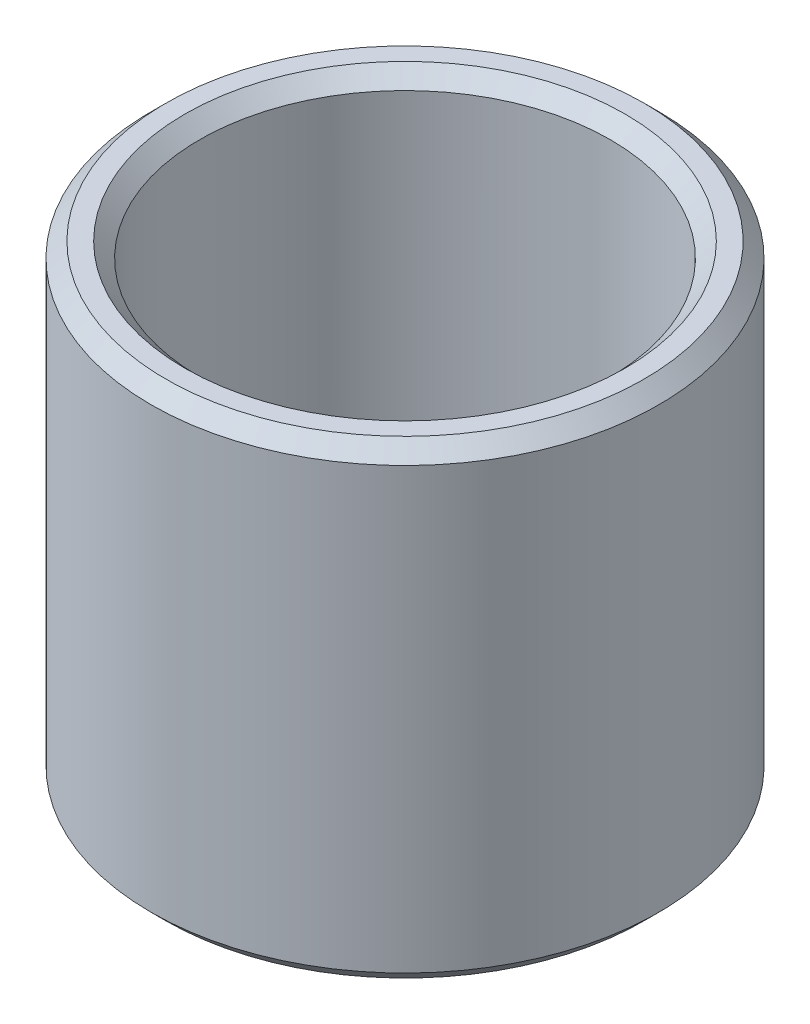
from build123d import *

# Parameters (mm, degrees)
SKETCH1_R           = 60
BOSS_EXTRUDE1_DEPTH = 110.872640761
SKETCH2_R           = 48.534594652
CUT_EXTRUDE1_DEPTH  = 140.616411891
CHAMFER1_SIZE       = 3.497396645


with BuildPart() as part:
    # Sketch1 → Boss-Extrude1 (new body)
    with BuildSketch(Plane(origin=(0, 0, 0), x_dir=(1, 0, 0), z_dir=(0, 1, 0))):
        Circle(SKETCH1_R)
    extrude(amount=BOSS_EXTRUDE1_DEPTH)

    # Sketch2 → Cut-Extrude1 (cut, through all)
    with BuildSketch(Plane(origin=(0, 0, 0), x_dir=(1, 0, 0), z_dir=(0, 1, 0))):
        Circle(SKETCH2_R)
    extrude(amount=CUT_EXTRUDE1_DEPTH, mode=Mode.SUBTRACT)

    # Chamfer1
    chamfer1_edges = [part.edges().sort_by_distance(p)[0] for p in [
        (-48.534594652, 110.872640761, 0),
        (-48.534594652, 0, 0),
        (-60, 0, 0),
        (-60, 110.872640761, 0),
    ]]
    chamfer(chamfer1_edges, length=CHAMFER1_SIZE)


solid = part.part
